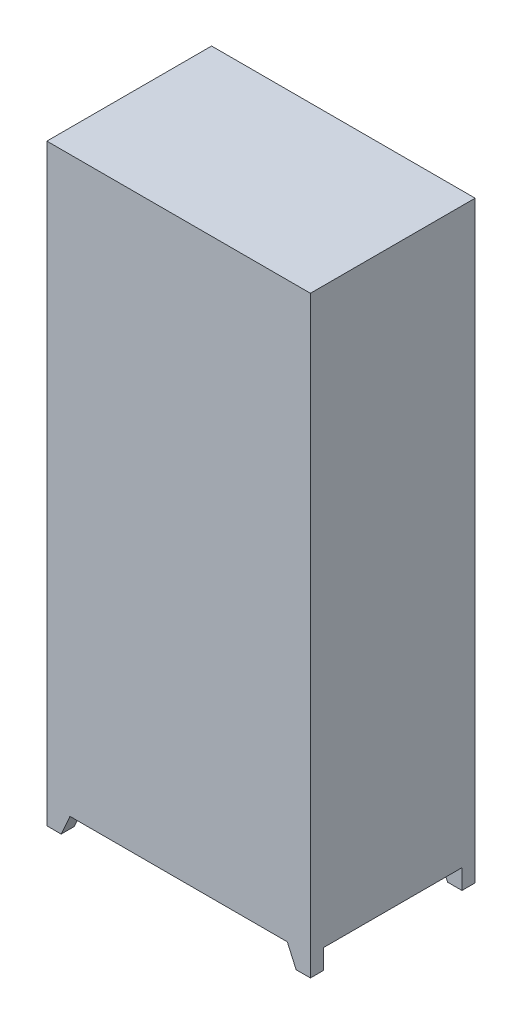
from build123d import *

# Parameters (mm, degrees)
BOSS_EXTRUDE1_DEPTH = 63.5
BOSS_EXTRUDE2_DEPTH = 5.08
BOSS_EXTRUDE3_START = 63.5
BOSS_EXTRUDE3_DEPTH = 5.08
SHELL1_OUTLINE_W    = 91.44
SHELL1_OUTLINE_H    = 210.82
SHELL1_DEPTH        = 58.42


# Read off the part's stored shape, not the designer's step: Shell1
with BuildPart() as part:
    # Sketch1 → Boss-Extrude1 (new body)
    with BuildSketch(Plane.XY):
        Polygon((-50.8, -106.68), (-41.900534076, -106.68), (41.900534076, -106.68), (50.8, -106.68), (50.8, 114.3), (-50.8, 114.3), align=None)
    extrude(amount=BOSS_EXTRUDE1_DEPTH)

    # Sketch1<4> → Boss-Extrude2 (add)
    with BuildSketch(Plane.XY):
        Polygon((50.8, -106.68), (41.900534076, -106.68), (45.287200742, -114.3), (50.8, -114.3), align=None)
        Polygon((-50.8, -114.3), (-45.287200742, -114.3), (-41.900534076, -106.68), (-50.8, -106.68), align=None)
    extrude(amount=BOSS_EXTRUDE2_DEPTH)

    # Sketch1<5> → Boss-Extrude3 (add)
    with BuildSketch(Plane.XY.offset(BOSS_EXTRUDE3_START)):
        Polygon((-50.8, -114.3), (-45.287200742, -114.3), (-41.900534076, -106.68), (-50.8, -106.68), align=None)
        Polygon((50.8, -106.68), (41.900534076, -106.68), (45.287200742, -114.3), (50.8, -114.3), align=None)
    extrude(amount=-BOSS_EXTRUDE3_DEPTH)

    # Shell1 outline → Shell1 (cut)
    with BuildSketch(Plane.XY):
        with Locations((0, 3.81)):
            Rectangle(SHELL1_OUTLINE_W, SHELL1_OUTLINE_H)
    extrude(amount=SHELL1_DEPTH, mode=Mode.SUBTRACT)


solid = part.part
